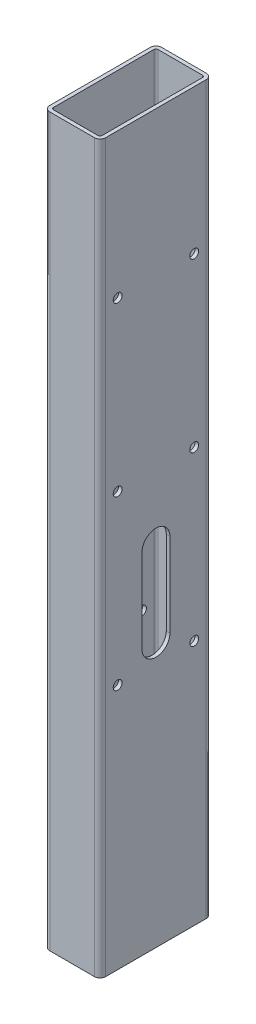
from build123d import *

# Parameters (mm, degrees)
EXTRUDE_THIN1_DEPTH = 330.2
CUT_EXTRUDE1_REACH  = 334.148
CUT_EXTRUDE4_REACH  = 334.148
SKETCH4_R           = 2.0193
CUT_EXTRUDE3_DEPTH  = 333.148099498


with BuildPart() as part:
    # Sketch1 → Extrude-Thin1 (new body)
    with BuildSketch(Plane(origin=(0, 0, 0), x_dir=(1, 0, 0), z_dir=(0, 1, 0))):
        with BuildLine():
            Line((-10.16, 25.4), (10.16, 25.4))
            ThreePointArc((10.16, 25.4), (11.956051224, 24.656051224), (12.7, 22.86))
            Line((12.7, 22.86), (12.7, -22.86))
            ThreePointArc((12.7, -22.86), (11.956051224, -24.656051224), (10.16, -25.4))
            Line((10.16, -25.4), (-10.16, -25.4))
            ThreePointArc((-10.16, -25.4), (-11.956051224, -24.656051224), (-12.7, -22.86))
            Line((-12.7, -22.86), (-12.7, 22.86))
            ThreePointArc((-12.7, 22.86), (-11.956051224, 24.656051224), (-10.16, 25.4))
        make_face()
        with BuildLine():
            Line((-10.16, 23.749), (10.16, 23.749))
            ThreePointArc((10.16, 23.749), (10.788617928, 23.488617928), (11.049, 22.86))
            Line((11.049, 22.86), (11.049, -22.86))
            ThreePointArc((11.049, -22.86), (10.788617928, -23.488617928), (10.16, -23.749))
            Line((10.16, -23.749), (-10.16, -23.749))
            ThreePointArc((-10.16, -23.749), (-10.788617928, -23.488617928), (-11.049, -22.86))
            Line((-11.049, -22.86), (-11.049, 22.86))
            ThreePointArc((-11.049, 22.86), (-10.788617928, 23.488617928), (-10.16, 23.749))
        make_face(mode=Mode.SUBTRACT)
    extrude(amount=-EXTRUDE_THIN1_DEPTH)

    # Sketch2 → Cut-Extrude1 (cut, up to next)
    with BuildSketch(Plane.ZY.offset(12.7), mode=Mode.PRIVATE) as cut_extrude1_sk1:
        with BuildLine():
            Line((2.5527, -74.399503105), (2.5527, -209.55))
            ThreePointArc((2.5527, -209.55), (0, -212.1027), (-2.5527, -209.55))
            Line((-2.5527, -209.55), (-2.5527, -74.399503105))
            ThreePointArc((-2.5527, -74.399503105), (0, -71.846803105), (2.5527, -74.399503105))
        make_face()
    cut_extrude1_tool1 = extrude(cut_extrude1_sk1.sketch, amount=-CUT_EXTRUDE1_REACH, mode=Mode.PRIVATE) & part.part
    add(cut_extrude1_tool1.solids().sort_by_distance((-12.7, -141.974752, 0))[0], mode=Mode.SUBTRACT)

    # Sketch5 → Cut-Extrude4 (cut, up to next)
    with BuildSketch(Plane(origin=(12.7, 0, 0), x_dir=(0, 0, -1), z_dir=(1, 0, 0)), mode=Mode.PRIVATE) as cut_extrude4_sk1:
        with BuildLine():
            Line((6.35, -171.45), (6.35, -209.55))
            ThreePointArc((6.35, -209.55), (0, -215.9), (-6.35, -209.55))
            Line((-6.35, -209.55), (-6.35, -171.45))
            ThreePointArc((-6.35, -171.45), (0, -165.1), (6.35, -171.45))
        make_face()
    cut_extrude4_tool1 = extrude(cut_extrude4_sk1.sketch, amount=-CUT_EXTRUDE4_REACH, mode=Mode.PRIVATE) & part.part
    add(cut_extrude4_tool1.solids().sort_by_distance((12.7, -190.5, 0))[0], mode=Mode.SUBTRACT)

    # Sketch4 → Cut-Extrude3 (cut, through all)
    with BuildSketch(Plane(origin=(12.7, 0, 0), x_dir=(0, 0, -1), z_dir=(1, 0, 0))):
        with Locations((-17.399, -218.174755305)):
            Circle(SKETCH4_R)
        with Locations((17.399, -218.174755305)):
            Circle(SKETCH4_R)
        with Locations((-17.399, -141.974755305)):
            Circle(SKETCH4_R)
        with Locations((17.399, -141.974755305)):
            Circle(SKETCH4_R)
        with Locations((-17.399, -65.774755305)):
            Circle(SKETCH4_R)
        with Locations((17.399, -65.774755305)):
            Circle(SKETCH4_R)
    extrude(amount=-CUT_EXTRUDE3_DEPTH, mode=Mode.SUBTRACT)


solid = part.part
